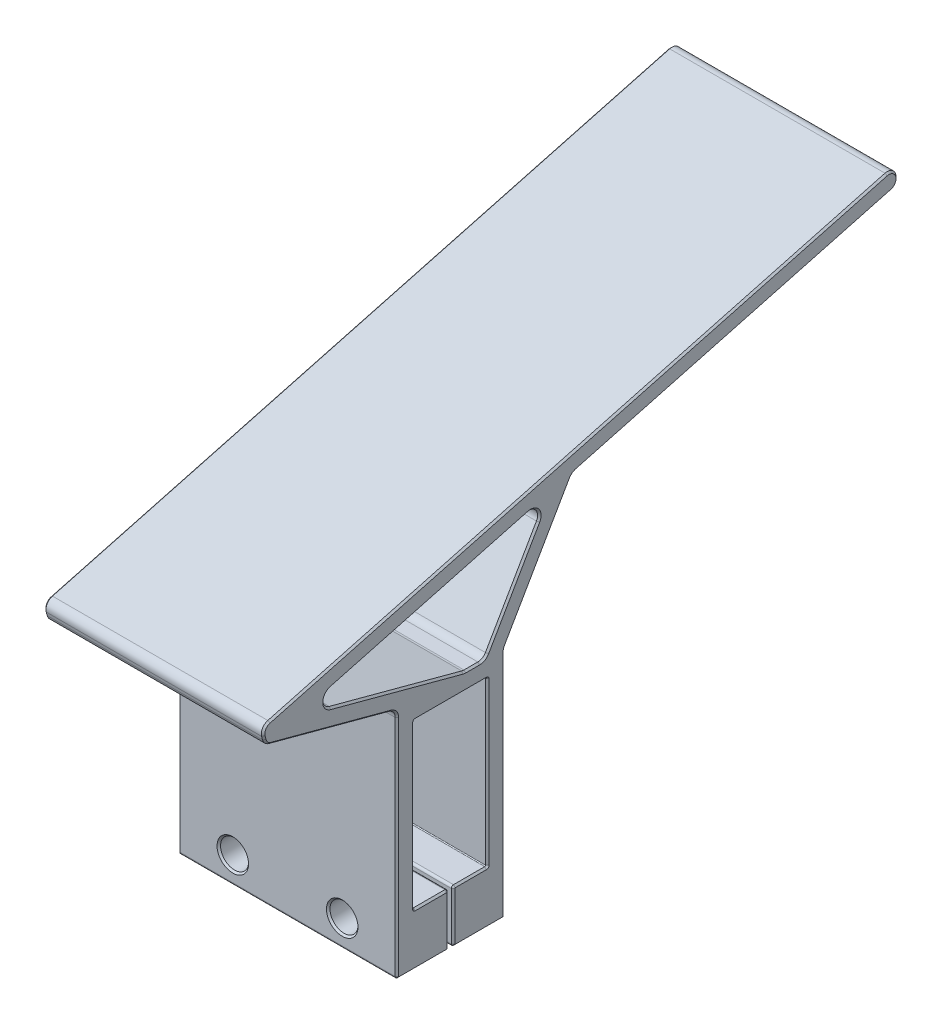
from build123d import *

# Parameters (mm, degrees)
SKETCH1_W               = 8
SKETCH1_H               = 11.83
BOSS_EXTRUDE1_DEPTH     = 25
CUT_EXTRUDE1_DEPTH      = 119.472964421
CUT_EXTRUDE1_DEPTH_BACK = 119.472964421
FILLET1_R               = 2
FILLET2_R               = 0.5
CHAMFER1_SIZE           = 0.4
FILLET3_R               = 0.2
CHAMFER2_SIZE           = 0.4


with BuildPart() as part:
    # Sketch1 → Boss-Extrude1 (new body)
    with BuildSketch(Plane.YZ):
        Polygon((-41.29, -4), (4, -4), (4, 0.618802154), (4, 5.205186779), (4, 20.66), (-41.29, 20.66), (-41.29, 8.83), (-37.29, 8.83), (-37.29, 16.66), (0, 16.66), (0, 0), (-37.29, 0), (-37.29, 7.83), (-41.29, 7.83), align=None)
        Polygon((4, 0.618802154), (4, -4), (30.836144658, -19.493855342), (50.861332538, -94.228873943), (54.725035843, -93.193597763), (15.902179078, 51.69527618), (12.038475773, 50.66), (4, 20.66), (4, 5.205186779), (14.109028134, 42.93259339), (29.372043043, -14.029753727), align=None)
        with Locations((-45.29, 14.745)):
            Rectangle(SKETCH1_W, SKETCH1_H)
        with Locations((-45.29, 1.915)):
            Rectangle(SKETCH1_W, SKETCH1_H)
    extrude(amount=BOSS_EXTRUDE1_DEPTH)

    # Sketch2 → Cut-Extrude1 (cut, two sides: drawn at the far end of the back side and taken through both)
    with BuildSketch(Plane.XY.offset(7.83).offset(-CUT_EXTRUDE1_DEPTH_BACK)):
        with BuildLine():
            ThreePointArc((9.3, -43.29), (12.5, -46.49), (15.7, -43.29))
            Line((15.7, -43.29), (9.3, -43.29))
        make_face()
        with BuildLine():
            Line((9.3, -43.29), (15.7, -43.29))
            ThreePointArc((15.7, -43.29), (12.5, -40.09), (9.3, -43.29))
        make_face()
    extrude(amount=CUT_EXTRUDE1_DEPTH + CUT_EXTRUDE1_DEPTH_BACK, mode=Mode.SUBTRACT)

    # Fillet1
    fillet1_edges = [part.edges().sort_by_distance(p)[0] for p in [
        (12.5, 4, -4),
        (12.5, 30.836144658, -19.493855342),
        (12.5, 50.861332538, -94.228873943),
        (12.5, 54.725035843, -93.193597763),
        (12.5, 15.902179078, 51.69527618),
        (12.5, 12.038475773, 50.66),
        (12.5, 14.109028134, 42.93259339),
        (12.5, 29.372043043, -14.029753727),
        (12.5, 4, 0.618802154),
        (12.5, 4, 5.205186779),
        (12.5, 4, 20.66),
    ]]
    fillet(fillet1_edges, radius=FILLET1_R - 0.0001)  # a hair under: the kernel refuses the full size

    # Fillet2
    fillet2_edges = [part.edges().sort_by_distance(p)[0] for p in [
        (12.5, -37.29, 8.83),
        (12.5, -49.29, 8.83),
        (12.5, -49.29, 20.66),
        (12.5, -49.29, -4),
        (12.5, -49.29, 7.83),
        (12.5, -37.29, 7.83),
    ]]
    fillet(fillet2_edges, radius=FILLET2_R)

    # Chamfer1
    chamfer1_edges = [part.edges().sort_by_distance(p)[0] for p in [
        (15.7, -43.29, 7.83),
        (15.7, -43.29, -4),
        (15.7, -43.29, 20.66),
        (15.7, -43.29, 8.83),
    ]]
    chamfer(chamfer1_edges, length=CHAMFER1_SIZE)

    # Mirror1: part across plane


with BuildPart() as part_1:
    add(part.part)
    add(part.part.mirror(Plane(origin=(0, 0, 0), x_dir=(0, 0, 1), z_dir=(1, 0, 0))))

    # Fillet3
    fillet3_edges = [part_1.edges().sort_by_distance(p)[0] for p in [
        (0, -37.29, 0),
        (0, 0, 0),
        (0, 0, 16.66),
        (0, -37.29, 16.66),
    ]]
    fillet(fillet3_edges, radius=FILLET3_R)

    # Chamfer2
    chamfer2_edges = [part_1.edges().sort_by_distance(p)[0] for p in [
        (25, 54.00763278, -92.779404911),
        (25, 51.27552539, -93.51147088),
        (25, 3.981740618, -4.06814494),
        (25, 30.70541894, -19.594164714),
        (25, 14.109028134, 37.20547315),
        (25, 27.408123551, -11.470324016),
        (25, 4.267935795, 0.773494957),
        (25, 4.017109422, 5.202934281),
        (25, 3.682884739, 21.073272655),
        (25, -43.29, 7.83),
        (25, -49.29, 14.745),
        (25, -43.29, 8.83),
        (25, -37.29, 12.895),
        (25, -49.29, 1.915),
        (25, -49.143553391, 20.513553391),
        (25, -49.143553391, -3.853553391),
        (25, -49.143553391, 8.976446609),
        (25, -49.143553391, 7.683553391),
        (25, -37.436446609, 8.976446609),
        (25, -37.436446609, 7.683553391),
        (-25, -43.29, 7.83),
        (-25, -49.29, 1.915),
        (-25, 17.291410002, -11.673799143),
        (-25, 40.697133492, -56.295566685),
        (-25, 35.313607461, -20.749160791),
        (-25, 13.562099547, 51.06825376),
        (-25, 8.068405021, 35.843494244),
        (-25, -23.162288622, 20.66),
        (-25, -37.29, 12.895),
        (-25, 15.095330785, -5.787090062),
        (-25, 4, 3.357669953),
        (-25, 8.122709007, 20.591346258),
        (-25, 22.081599912, 13.178550448),
        (-25, -43.29, 8.83),
        (-25, -49.29, 14.745),
        (-25, -22.662935795, -4),
        (-25, 3.981740618, -4.06814494),
        (-25, 30.70541894, -19.594164714),
        (-25, 54.00763278, -92.779404911),
        (-25, 51.27552539, -93.51147088),
        (-25, 15.487986226, 50.977873117),
        (-25, 12.257244433, 50.441231339),
        (-25, 14.109028134, 37.20547315),
        (-25, 27.408123551, -11.470324016),
        (-25, 4.267935795, 0.773494957),
        (-25, 4.017109422, 5.202934281),
        (-25, 3.682884739, 21.073272655),
        (-25, -37.436446609, 7.683553391),
        (-25, -37.436446609, 8.976446609),
        (-25, -49.143553391, 7.683553391),
        (-25, -49.143553391, 8.976446609),
        (-25, -49.143553391, -3.853553391),
        (-25, -49.143553391, 20.513553391),
        (-25, -18.645, 0),
        (25, -18.645, 0),
        (-25, 0, 8.33),
        (25, 0, 8.33),
        (-25, -37.29, 3.765),
        (25, -37.29, 3.765),
        (-25, -18.645, 16.66),
        (25, -18.645, 16.66),
        (-25, -0.058578644, 0.058578644),
        (25, -0.058578644, 0.058578644),
        (-25, -37.231421356, 0.058578644),
        (25, -37.231421356, 0.058578644),
        (-25, -37.231421356, 16.601421356),
        (25, -37.231421356, 16.601421356),
        (-25, -0.058578644, 16.601421356),
        (25, -0.058578644, 16.601421356),
        (25, 17.291410002, -11.673799143),
        (25, -22.662935795, -4),
        (25, 40.697133492, -56.295566685),
        (25, 15.095330785, -5.787090062),
        (25, 4, 3.357669953),
        (25, 8.122709007, 20.591346258),
        (25, 22.081599912, 13.178550448),
        (25, 35.313607461, -20.749160791),
        (25, 13.562099547, 51.06825376),
        (25, 8.068405021, 35.843494244),
        (25, -23.162288622, 20.66),
        (25, 12.257244433, 50.441231339),
        (25, 15.487986226, 50.977873117),
    ]]
    chamfer(chamfer2_edges, length=CHAMFER2_SIZE)


solid = part_1.part
